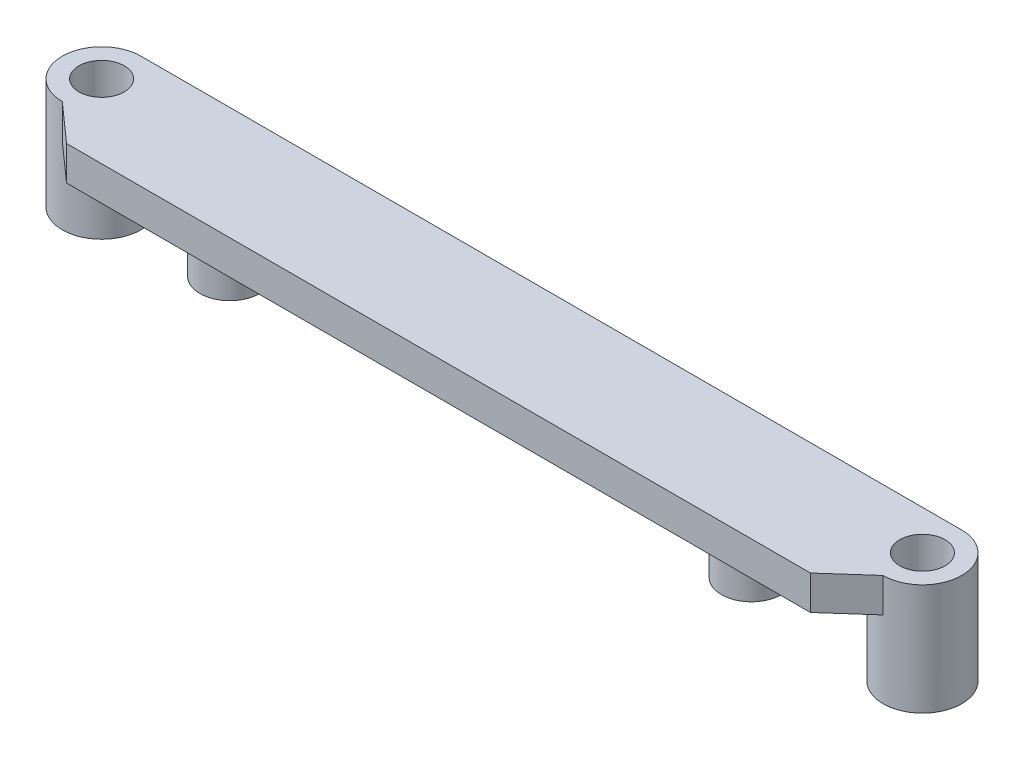
from build123d import *
from build123d.topology import SkipClean

# Parameters (mm, degrees)
BOSS_EXTRUDE1_DEPTH     = 2
BOSS_EXTRUDE2_START     = 4.5
SKETCH6_R               = 2.3
BOSS_EXTRUDE2_DEPTH     = 4.5
CUT_EXTRUDE1_DEPTH      = 33.640159313
CUT_EXTRUDE1_DEPTH_BACK = 33.640159313
SKETCH1_R               = 1.325
SKETCH7_R               = 1.75
BOSS_EXTRUDE3_DEPTH     = 3


with BuildPart() as part:
    # Sketch5 → Boss-Extrude1 (new body)
    with BuildSketch(Plane(origin=(0, 0, 0), x_dir=(1, 0, 0), z_dir=(0, 1, 0))):
        with BuildLine():
            Line((-24, 14.2), (-21.75, 12.2))
            Line((-21.75, 12.2), (21.75, 12.2))
            Line((21.75, 12.2), (24, 14.2))
            ThreePointArc((24, 14.2), (26.3, 16.5), (24, 18.8))
            Line((24, 18.8), (-24, 18.8))
            ThreePointArc((-24, 18.8), (-26.3, 16.5), (-24, 14.2))
        make_face()
    extrude(amount=BOSS_EXTRUDE1_DEPTH)

    # Sketch6 → Boss-Extrude2 (add)
    with SkipClean():  # the faces are left unmerged after this step: merging them gives an invalid solid
        with BuildSketch(Plane.XZ.offset(BOSS_EXTRUDE2_START)):
            with Locations((-24, -16.5)):
                Circle(SKETCH6_R)
            with Locations((24, -16.5)):
                Circle(SKETCH6_R)
        extrude(amount=-BOSS_EXTRUDE2_DEPTH)

    # Sketch1 → Cut-Extrude1 (cut, two sides: drawn at the far end of the back side and taken through both)
    with SkipClean():  # the faces are left unmerged after this step: merging them gives an invalid solid
        with BuildSketch(Plane(origin=(0, 0, 0), x_dir=(1, 0, 0), z_dir=(0, 1, 0)).offset(-CUT_EXTRUDE1_DEPTH_BACK)):
            with Locations((-24, 16.5)):
                Circle(SKETCH1_R)
            with Locations((24, 16.5)):
                Circle(SKETCH1_R)
            with Locations((-24, -16.5)):
                Circle(SKETCH1_R)
            with Locations((24, -16.5)):
                Circle(SKETCH1_R)
        extrude(amount=CUT_EXTRUDE1_DEPTH + CUT_EXTRUDE1_DEPTH_BACK, mode=Mode.SUBTRACT)

    # Sketch7 → Boss-Extrude3 (add)
    with SkipClean():  # the faces are left unmerged after this step: merging them gives an invalid solid
        with BuildSketch(Plane.XZ):
            with Locations((-15.25, -15.25)):
                Circle(SKETCH7_R)
            with Locations((15.25, -15.25)):
                Circle(SKETCH7_R)
        extrude(amount=BOSS_EXTRUDE3_DEPTH)


solid = part.part
